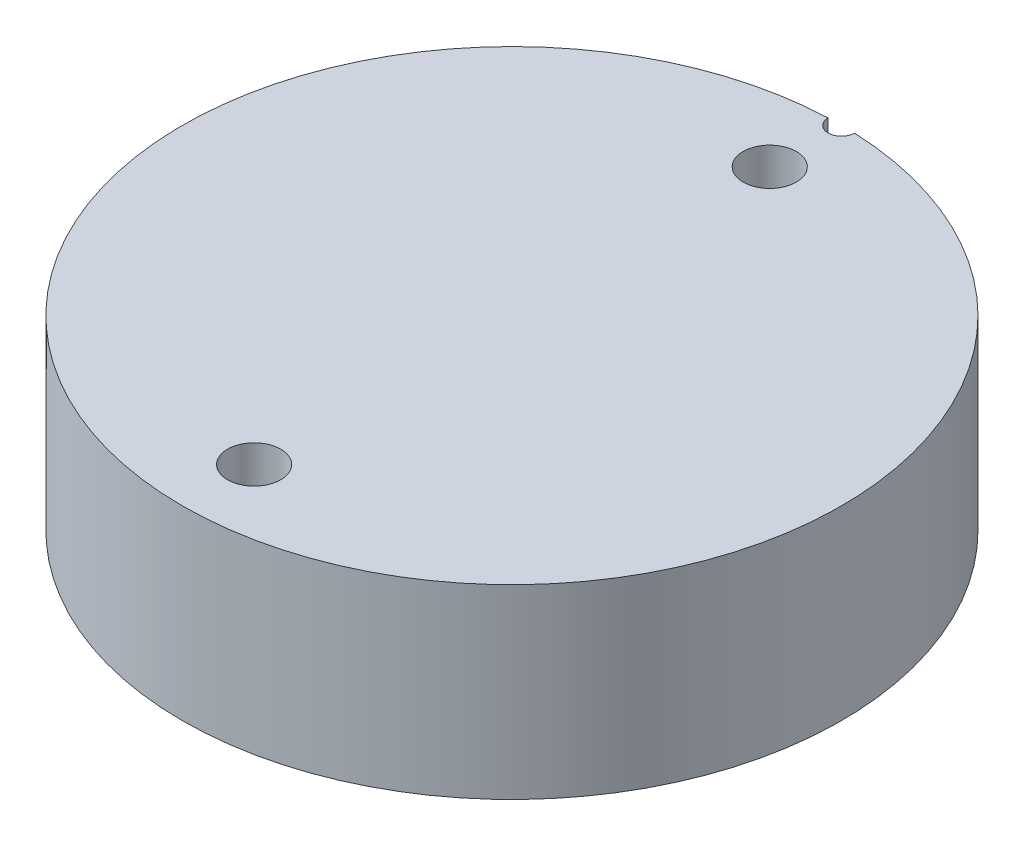
from build123d import *

# Parameters (mm, degrees)
SKETCH1_R           = 12.4
BOSS_EXTRUDE1_DEPTH = 7
SKETCH2_R           = 1
CUT_EXTRUDE1_DEPTH  = 19.881737208
WRAP1_START         = -0.5
WRAP1_DEPTH         = 0.5
SKETCH4_R           = 0.5
CUT_EXTRUDE2_DEPTH  = 7


# Read off the part's stored shape, not the designer's step: Wrap1
with BuildPart() as part:
    # Sketch1 → Boss-Extrude1 (new body)
    with BuildSketch(Plane(origin=(0, 0, 0), x_dir=(1, 0, 0), z_dir=(0, 1, 0))):
        with Locations(Location((0, 0, 0), (0, 0, 270))):
            Circle(SKETCH1_R)
    extrude(amount=BOSS_EXTRUDE1_DEPTH)

    # Sketch2 → Cut-Extrude1 (cut, through all)
    with BuildSketch(Plane(origin=(0, 0, 0), x_dir=(-1, 0, 0), z_dir=(0, -1, 0))):
        with Locations(Location((0, 9.7, 0), (0, 0, 90))):
            Circle(SKETCH2_R)
        with Locations(Location((0, -9.7, 0), (0, 0, 90))):
            Circle(SKETCH2_R)
    extrude(amount=-CUT_EXTRUDE1_DEPTH, mode=Mode.SUBTRACT)

    # Wrap1 outline → Wrap1 (cut)
    # profile 1 of 6: a face of its own
    with BuildSketch(Plane.XZ.offset(WRAP1_START)):
        with BuildLine():
            Line((-2.031477868, -3.153846154), (-2.210263925, -3.153846154))
            add(Edge.make_bspline(
                [(-2.210263925, -3.153846154), (-2.304050451, -3.153758336), (-2.51704944, -3.153558894), (-2.728459302, -3.180072549), (-2.846782355, -3.194911859)],
                knots=[0, 0, 0, 0, 0.440314414, 1, 1, 1, 1], degree=3))
            add(Edge.make_bspline(
                [(-2.846782355, -3.194911859), (-2.973262529, -3.243260598), (-3.258825144, -3.352420729), (-3.314541645, -3.658766612), (-3.345580432, -3.829427083)],
                knots=[0, 0, 0, 0, 0.442915733, 1, 1, 1, 1], degree=3))
            add(Edge.make_bspline(
                [(-3.345580432, -3.829427083), (-3.329443977, -3.960601874), (-3.292993392, -4.25691217), (-3.019329137, -4.388888631), (-2.866814406, -4.462439904)],
                knots=[0, 0, 0, 0, 0.442694001, 1, 1, 1, 1], degree=3))
            add(Edge.make_bspline(
                [(-2.866814406, -4.462439904), (-2.783809352, -4.4741997), (-2.595026902, -4.500945579), (-2.404280932, -4.500339561), (-2.297403348, -4.5)],
                knots=[0, 0, 0, 0, 0.439686282, 1, 1, 1, 1], degree=3))
            Line((-2.297403348, -4.5), (-1.807118893, -4.5))
            Line((-1.807118893, -4.5), (-1.807118893, -2))
            Line((-1.807118893, -2), (-2.031477868, -2))
            Line((-2.031477868, -2), (-2.031477868, -3.153846154))
        make_face()
        with BuildLine():
            Line((-2.031477868, -4.243589744), (-2.488709438, -4.243589744))
            add(Edge.make_bspline(
                [(-2.488709438, -4.243589744), (-2.636778663, -4.245832648), (-2.858668728, -4.249193765), (-3.087398478, -4.043591474), (-3.109947004, -3.900148285), (-3.121221457, -3.828425481)],
                knots=[0, 0, 0, 0, 0.500718692, 0.750355136, 1, 1, 1, 1], degree=3))
            add(Edge.make_bspline(
                [(-3.121221457, -3.828425481), (-3.110084042, -3.754426269), (-3.087818883, -3.606492103), (-2.846982746, -3.401705038), (-2.620432253, -3.403529508), (-2.469178188, -3.404747596)],
                knots=[0, 0, 0, 0, 0.249615048, 0.499013341, 1, 1, 1, 1], degree=3))
            Line((-2.469178188, -3.404747596), (-2.031477868, -3.41025641))
            Line((-2.031477868, -3.41025641), (-2.031477868, -4.243589744))
        make_face(mode=Mode.SUBTRACT)
    # profile 2 of 6: a face of its own
    with BuildSketch(Plane.XZ.offset(WRAP1_START)):
        with BuildLine():
            add(Edge.make_bspline(
                [(-1.29429838, -3.251001603), (-1.233767931, -3.555711086), (-1.13419239, -4.056973037), (-0.546785242, -4.501043755), (-0.158404316, -4.54307981), (0.035829825, -4.564102564)],
                knots=[0, 0, 0, 0, 0.436607301, 0.718240291, 1, 1, 1, 1], degree=3))
            add(Edge.make_bspline(
                [(0.035829825, -4.564102564), (0.337186775, -4.501451173), (0.832784511, -4.398417587), (1.263646175, -3.813137767), (1.310482432, -3.430401214), (1.333906748, -3.238982372)],
                knots=[0, 0, 0, 0, 0.436786424, 0.718318801, 1, 1, 1, 1], degree=3))
            add(Edge.make_bspline(
                [(1.333906748, -3.238982372), (1.271523902, -2.938761966), (1.168876948, -2.444768626), (0.592223534, -2.001267596), (0.207932181, -1.957686637), (0.015797773, -1.935897436)],
                knots=[0, 0, 0, 0, 0.436529586, 0.718281316, 1, 1, 1, 1], degree=3))
            add(Edge.make_bspline(
                [(0.015797773, -1.935897436), (-0.285288336, -1.99709136), (-0.780661114, -2.09777287), (-1.227049335, -2.673889596), (-1.271884529, -3.058652359), (-1.29429838, -3.251001603)],
                knots=[0, 0, 0, 0, 0.436613243, 0.71835368, 1, 1, 1, 1], degree=3))
        make_face()
        with BuildLine():
            add(Edge.make_bspline(
                [(0.024812197, -4.307692308), (-0.222096477, -4.260150518), (-0.627501361, -4.182090587), (-1.011681906, -3.724534497), (-1.050518548, -3.409193504), (-1.069939406, -3.251502404)],
                knots=[0, 0, 0, 0, 0.437825955, 0.718876246, 1, 1, 1, 1], degree=3))
            add(Edge.make_bspline(
                [(-1.069939406, -3.251502404), (-1.019780636, -3.002340488), (-0.937269286, -2.592468281), (-0.447437557, -2.247759346), (-0.132657177, -2.210797775), (0.024812197, -2.192307692)],
                knots=[0, 0, 0, 0, 0.43655613, 0.718136331, 1, 1, 1, 1], degree=3))
            add(Edge.make_bspline(
                [(0.024812197, -2.192307692), (0.269360953, -2.239222325), (0.671380896, -2.316346488), (1.051425571, -2.770762078), (1.090179676, -3.083624875), (1.109547773, -3.239983974)],
                knots=[0, 0, 0, 0, 0.437205081, 0.718732595, 1, 1, 1, 1], degree=3))
            add(Edge.make_bspline(
                [(1.109547773, -3.239983974), (1.059317235, -3.487706151), (0.97667219, -3.89528709), (0.494781539, -4.245984232), (0.181454127, -4.287124855), (0.024812197, -4.307692308)],
                knots=[0, 0, 0, 0, 0.436595419, 0.718336864, 1, 1, 1, 1], degree=3))
        make_face(mode=Mode.SUBTRACT)
    # profile 3 of 6: a face of its own
    with BuildSketch(Plane.XZ.offset(WRAP1_START)):
        Polygon((1.654419568, -4.5), (2.968522132, -4.5), (2.968522132, -4.243589744), (2.423650338, -4.243589744), (2.423650338, -2), (2.199291363, -2), (2.199291363, -4.243589744), (1.654419568, -4.243589744), align=None)
    # profile 4 of 6: a face of its own
    with BuildSketch(Plane.XZ.offset(WRAP1_START)):
        Polygon((0, -8.309401077), (2, -4.845299462), (-2, -4.845299462), align=None)
    # profile 5 of 6: a face of its own
    with BuildSketch(Plane.XZ.offset(WRAP1_START)):
        Polygon((-2, 4.845299462), (2, 4.845299462), (0, 8.309401077), align=None)
    # profile 6 of 6: a face of its own
    with BuildSketch(Plane.XZ.offset(WRAP1_START)):
        Polygon((0, -11.777350269), (0.5, -10.911324865), (-0.5, -10.911324865), align=None)
    extrude(amount=WRAP1_DEPTH, mode=Mode.SUBTRACT)

    # Sketch4 → Cut-Extrude2 (cut)
    with BuildSketch(Plane(origin=(0, 0, 0), x_dir=(-1, 0, 0), z_dir=(0, -1, 0))):
        with Locations((0, 12.4)):
            Circle(SKETCH4_R)
    extrude(amount=-CUT_EXTRUDE2_DEPTH, mode=Mode.SUBTRACT)


solid = part.part
